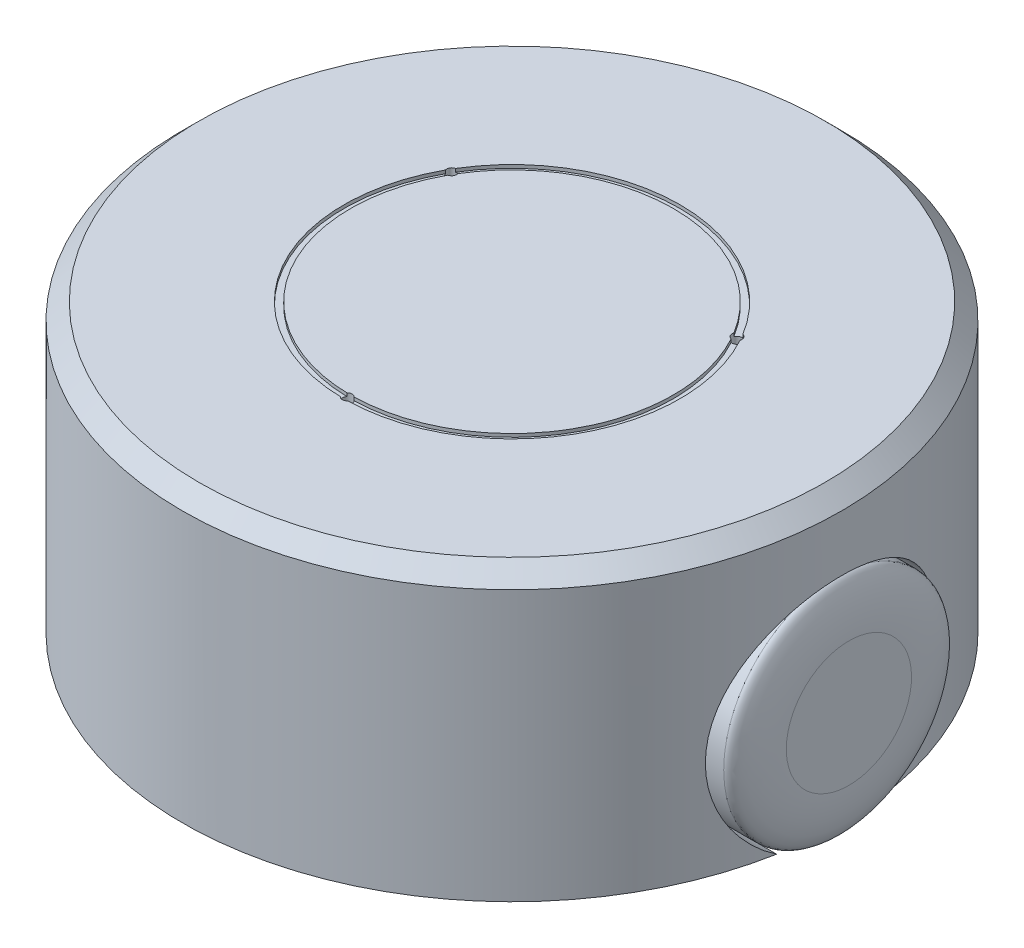
from build123d import *

# Parameters (mm, degrees)
CROQUIS1_R                    = 100
SALIENTE_EXTRUIR1_DEPTH       = 87
CHAFL_N1_SIZE                 = 5
CORTAR_EXTRUIR1_DEPTH         = 167.039152009
CORTAR_EXTRUIR1_DEPTH_BACK    = 167.039152009
CROQUIS2_R                    = 35
SALIENTE_EXTRUIR2_REACH       = 168.039
CROQUIS4_W                    = 124.50080221
CROQUIS4_H                    = 118.457073948
CROQUIS5_R                    = 34
SALIENTE_EXTRUIR3_DEPTH       = 40
REDONDEO1_SIZE                = 4
REDONDEO1_SIZE_2              = 15
REDONDEO1_OF_SIMETR_A2_SIZE   = 4
REDONDEO1_OF_SIMETR_A2_SIZE_2 = 15
CORTAR_EXTRUIR2_DEPTH         = 170.517387264
CORTAR_EXTRUIR2_DEPTH_BACK    = 1
CROQUIS6_R                    = 51
CROQUIS6_R_2                  = 49
CROQUIS7_R                    = 1.5
CORTAR_EXTRUIR3_DEPTH         = 10


with BuildPart() as part:
    # Croquis1 → Saliente-Extruir1 (new body)
    with BuildSketch(Plane(origin=(0, 0, 0), x_dir=(1, 0, 0), z_dir=(0, 1, 0))):
        with Locations(Location((0, 0, 0), (0, 0, 270))):
            Circle(CROQUIS1_R)
    extrude(amount=SALIENTE_EXTRUIR1_DEPTH)

    # Chaflán1
    chafl_n1_edges = [part.edges().sort_by_distance(p)[0] for p in [
        (0, 87, -100),
    ]]
    chamfer(chafl_n1_edges, length=CHAFL_N1_SIZE)

    # Croquis2 → Cortar-Extruir1 (cut, two sides: drawn at the far end of the back side and taken through both)
    with BuildSketch(Plane(origin=(0, 0, 0), x_dir=(0, 0, -1), z_dir=(1, 0, 0)).offset(-CORTAR_EXTRUIR1_DEPTH_BACK)):
        with Locations((0, 30)):
            Circle(CROQUIS2_R)
    extrude(amount=CORTAR_EXTRUIR1_DEPTH + CORTAR_EXTRUIR1_DEPTH_BACK, mode=Mode.SUBTRACT)

    # Croquis4 → Saliente-Extruir2 (add, up to next)
    with BuildSketch(Plane(origin=(0, 0, 0), x_dir=(1, 0, 0), z_dir=(0, 1, 0)), mode=Mode.PRIVATE) as saliente_extruir2_sk1:
        Rectangle(CROQUIS4_W, CROQUIS4_H)
    saliente_extruir2_tool1 = extrude(saliente_extruir2_sk1.sketch, amount=SALIENTE_EXTRUIR2_REACH, mode=Mode.PRIVATE) - part.part
    add(saliente_extruir2_tool1.solids().sort_by_distance((0, 0, 0))[0])

    # Croquis5 → Saliente-Extruir3 (add)
    with BuildSketch(Plane.ZY.offset(62.250401105)):
        with Locations(Location((0, 30, 0), (0, 0, 241.927513064))):
            Circle(CROQUIS5_R)
    saliente_extruir3 = extrude(amount=SALIENTE_EXTRUIR3_DEPTH)

    # Redondeo1
    # a fillet whose section is not a circle: 15, 4 mm, written as the material it takes off along each edge
    with BuildSketch(Plane(origin=(-102.250401105, 30, 0), x_dir=(0, -0.882352941175263, -0.470588235296382), z_dir=(0, 0.470588235296382, -0.882352941175263))) as redondeo1_piece_1:
        with BuildLine():
            Bezier((34, -REDONDEO1_SIZE), (34, 0), (34 - REDONDEO1_SIZE_2, 0), weights=[1, 0.707106781, 1])
            Line((34 - REDONDEO1_SIZE_2, 0), (34, 0))
            Line((34, 0), (34, -REDONDEO1_SIZE))
        make_face()
    revolve(axis=Axis((-102.250401105, 30, 0), (-1, 0, 0)), mode=Mode.SUBTRACT)

    # Simetría2: Saliente-Extruir3 across plane
    add(saliente_extruir3.mirror(Plane(origin=(0, 0, 0), x_dir=(0, 0, 1), z_dir=(1, 0, 0))))

    # Redondeo1 of Simetría2
    # a fillet whose section is not a circle: 15, 4 mm, written as the material it takes off along each edge
    with BuildSketch(Plane(origin=(102.250401105, 30, 0), x_dir=(0, -0.882352941175263, -0.470588235296382), z_dir=(0, 0.470588235296382, -0.882352941175263))) as redondeo1_of_simetr_a2_piece_1:
        with BuildLine():
            Bezier((34, REDONDEO1_OF_SIMETR_A2_SIZE), (34, 0), (34 - REDONDEO1_OF_SIMETR_A2_SIZE_2, 0), weights=[1, 0.707106781, 1])
            Line((34 - REDONDEO1_OF_SIMETR_A2_SIZE_2, 0), (34, 0))
            Line((34, 0), (34, REDONDEO1_OF_SIMETR_A2_SIZE))
        make_face()
    revolve(axis=Axis((102.250401105, 30, 0), (-1, 0, 0)), mode=Mode.SUBTRACT)

    # Croquis6 → Cortar-Extruir2 (cut, two sides: drawn at the far end of the back side and taken through both)
    with BuildSketch(Plane(origin=(0, 87, 0), x_dir=(1, 0, 0), z_dir=(0, 1, 0)).offset(-CORTAR_EXTRUIR2_DEPTH_BACK)):
        with Locations(Location((0, 0, 0), (0, 0, 270))):
            Circle(CROQUIS6_R)
        with Locations(Location((0, 0, 0), (0, 0, 270))):
            Circle(CROQUIS6_R_2, mode=Mode.SUBTRACT)
    extrude(amount=CORTAR_EXTRUIR2_DEPTH + CORTAR_EXTRUIR2_DEPTH_BACK, mode=Mode.SUBTRACT)

    # Croquis7 → Cortar-Extruir3 (cut)
    with BuildSketch(Plane(origin=(0, 87, 0), x_dir=(1, 0, 0), z_dir=(0, 1, 0))):
        with Locations(Location((0, -50, 0), (0, 0, 270))):
            Circle(CROQUIS7_R)
        with Locations(Location((-43.301270189, 25, 0), (0, 0, 270))):
            Circle(CROQUIS7_R)
        with Locations(Location((43.301270189, 25, 0), (0, 0, 270))):
            Circle(CROQUIS7_R)
    extrude(amount=-CORTAR_EXTRUIR3_DEPTH, mode=Mode.SUBTRACT)


solid = part.part
